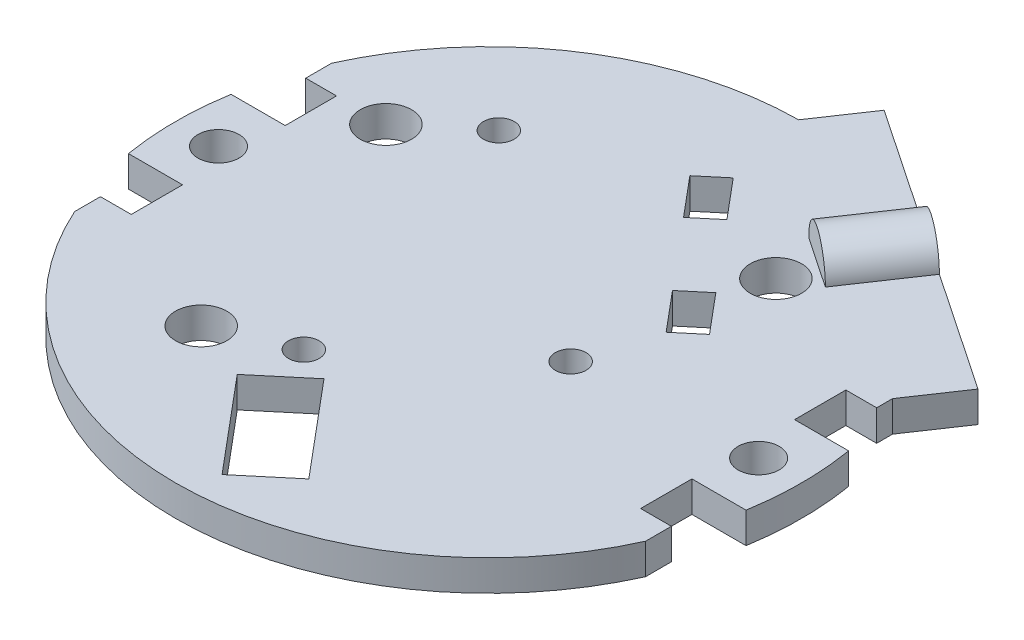
from build123d import *

# Parameters (mm, degrees)
CROQUIS1_R              = 30.5
SALIENTE_EXTRUIR1_DEPTH = 3
CORTAR_EXTRUIR3_START   = -4
CORTAR_EXTRUIR3_DEPTH   = 4
CORTAR_EXTRUIR5_DEPTH   = 4
CROQUIS8_R              = 2.5
CROQUIS8_R_2            = 1.5
CORTAR_EXTRUIR6_DEPTH   = 10
CORTAR_EXTRUIR8_START   = -3
CROQUIS10_R             = 2
CORTAR_EXTRUIR8_DEPTH   = 3
CORTAR_EXTRUIR9_START   = -3
CROQUIS11_R             = 2.5
CORTAR_EXTRUIR9_DEPTH   = 3
CROQUIS13_W             = 33.894616986
CROQUIS13_H             = 3
SALIENTE_EXTRUIR2_DEPTH = 6
CROQUIS14_R             = 3
SALIENTE_EXTRUIR3_DEPTH = 8
CROQUIS17_R             = 1.5
CORTAR_EXTRUIR10_DEPTH  = 7


with BuildPart() as part:
    # Croquis1 → Saliente-Extruir1 (new body)
    with BuildSketch(Plane(origin=(0, 0, 0), x_dir=(1, 0, 0), z_dir=(0, 1, 0))):
        Circle(CROQUIS1_R)
    extrude(amount=SALIENTE_EXTRUIR1_DEPTH)

    # Croquis5 → Cortar-Extruir3 (cut)
    with BuildSketch(Plane(origin=(0, 3, 0), x_dir=(1, 0, 0), z_dir=(0, 1, 0)).offset(CORTAR_EXTRUIR3_START)):
        with BuildLine():
            Line((30.087372767, -5), (24.814059068, -5))
            Line((24.814059068, -5), (24.814059068, -10))
            Line((24.814059068, -10), (28.814059068, -10))
            ThreePointArc((28.814059068, -10), (29.556634924, -7.526973624), (30.087372767, -5))
        make_face()
        with BuildLine():
            Line((24.814059068, 5), (30.087372767, 5))
            ThreePointArc((30.087372767, 5), (29.556634924, 7.526973624), (28.814059068, 10))
            Line((28.814059068, 10), (24.814059068, 10))
            Line((24.814059068, 10), (24.814059068, 5))
        make_face()
        with BuildLine():
            ThreePointArc((-30.087372767, -5), (-29.556634924, -7.526973624), (-28.814059068, -10))
            Line((-28.814059068, -10), (-24.814059068, -10))
            Line((-24.814059068, -10), (-24.814059068, -5))
            Line((-24.814059068, -5), (-30.087372767, -5))
        make_face()
        with BuildLine():
            Line((-24.814059068, 10), (-28.814059068, 10))
            ThreePointArc((-28.814059068, 10), (-29.556634924, 7.526973624), (-30.087372767, 5))
            Line((-30.087372767, 5), (-24.814059068, 5))
            Line((-24.814059068, 5), (-24.814059068, 10))
        make_face()
    extrude(amount=CORTAR_EXTRUIR3_DEPTH, mode=Mode.SUBTRACT)

    # Croquis7 → Cortar-Extruir5 (cut)
    with BuildSketch(Plane(origin=(0, 3, 0), x_dir=(1, 0, 0), z_dir=(0, 1, 0))):
        Polygon((1.428390211, 22.411430151), (-0.869743118, 20.483067322), (2.34419493, 16.652845106), (4.642328259, 18.581207935), align=None)
        Polygon((10.266719844, 11.878319058), (7.968586515, 9.949956229), (11.182524563, 6.119734013), (13.480657893, 8.048096842), align=None)
    extrude(amount=-CORTAR_EXTRUIR5_DEPTH, mode=Mode.SUBTRACT)

    # Croquis8 → Cortar-Extruir6 (cut)
    with BuildSketch(Plane(origin=(0, 3, 0), x_dir=(1, 0, 0), z_dir=(0, 1, 0))):
        with Locations((12, 16)):
            Circle(CROQUIS8_R)
        with Locations((9, -1)):
            Circle(CROQUIS8_R_2)
        with Locations((-12, -16)):
            Circle(CROQUIS8_R)
        Polygon((-6.154858987, -18.33209617), (1.558592329, -27.524629488), (6.154858987, -23.66790383), (-1.558592329, -14.475370512), align=None)
        with Locations((-5, -13)):
            Circle(CROQUIS8_R_2)
        with Locations((-14, 15)):
            Circle(CROQUIS8_R_2)
    extrude(amount=-CORTAR_EXTRUIR6_DEPTH, mode=Mode.SUBTRACT)

    # Croquis10 → Cortar-Extruir8 (cut)
    with BuildSketch(Plane(origin=(0, 3, 0), x_dir=(1, 0, 0), z_dir=(0, 1, 0)).offset(CORTAR_EXTRUIR8_START)):
        with BuildLine():
            Line((-28.814059068, 10), (-27.814059068, 10))
            Line((-27.814059068, 10), (-27.814059068, 12.515115586))
            ThreePointArc((-27.814059068, 12.515115586), (-28.341972277, 11.268655974), (-28.814059068, 10))
        make_face()
        with BuildLine():
            ThreePointArc((28.814059069, 10), (28.341972277, 11.268655974), (27.814059069, 12.515115586))
            Line((27.814059069, 12.515115586), (27.814059069, 10))
            Line((27.814059069, 10), (28.814059069, 10))
        make_face()
        with BuildLine():
            Line((-27.814059068, -12.515115586), (-27.814059068, -10))
            Line((-27.814059068, -10), (-28.814059068, -10))
            ThreePointArc((-28.814059068, -10), (-28.341972277, -11.268655974), (-27.814059068, -12.515115586))
        make_face()
        with BuildLine():
            Line((27.814059069, -10), (27.814059069, -12.515115586))
            ThreePointArc((27.814059069, -12.515115586), (28.341972277, -11.268655974), (28.814059068, -10))
            Line((28.814059068, -10), (27.814059069, -10))
        make_face()
        with Locations((-26.314059068, 0)):
            Circle(CROQUIS10_R)
        with Locations((26.314059069, 0)):
            Circle(CROQUIS10_R)
    extrude(amount=CORTAR_EXTRUIR8_DEPTH, mode=Mode.SUBTRACT)

    # Croquis11 → Cortar-Extruir9 (cut)
    with BuildSketch(Plane(origin=(0, 3, 0), x_dir=(1, 0, 0), z_dir=(0, 1, 0)).offset(CORTAR_EXTRUIR9_START)):
        with BuildLine():
            Line((-0.28585192, 30.498660441), (27.814059069, 11.545031156))
            Line((27.814059069, 11.545031156), (27.814059069, 12.515115586))
            ThreePointArc((27.814059069, 12.515115586), (16.440879496, 25.689442995), (-0.28585192, 30.498660441))
        make_face()
        with Locations((-20, 10)):
            Circle(CROQUIS11_R)
    extrude(amount=CORTAR_EXTRUIR9_DEPTH, mode=Mode.SUBTRACT)

    # Croquis13 → Saliente-Extruir2 (add)
    with BuildSketch(Plane(origin=(14.04954782, 0, -20.829311224), x_dir=(-0.8290375725550413, 0, -0.5591929034707476), z_dir=(0.5591929034707475, 0, -0.8290375725550412))):
        with Locations((0.344307973, 1.5)):
            Rectangle(CROQUIS13_W, CROQUIS13_H)
    extrude(amount=SALIENTE_EXTRUIR2_DEPTH)

    # Croquis14 → Saliente-Extruir3 (add)
    with BuildSketch(Plane(origin=(17.404705241, 0, -25.803536659), x_dir=(-0.8290375725550413, 0, -0.5591929034707476), z_dir=(0.5591929034707476, 0, -0.8290375725550413))):
        with Locations((0.344307973, 3)):
            Circle(CROQUIS14_R)
    extrude(amount=-SALIENTE_EXTRUIR3_DEPTH)

    # Croquis17 → Cortar-Extruir10 (cut)
    with BuildSketch(Plane(origin=(17.404705241, 0, -25.803536659), x_dir=(-0.8290375725550413, 0, -0.5591929034707476), z_dir=(0.5591929034707476, 0, -0.8290375725550413))):
        with Locations((0.344307973, 3)):
            Circle(CROQUIS17_R)
    extrude(amount=-CORTAR_EXTRUIR10_DEPTH, mode=Mode.SUBTRACT)


solid = part.part
